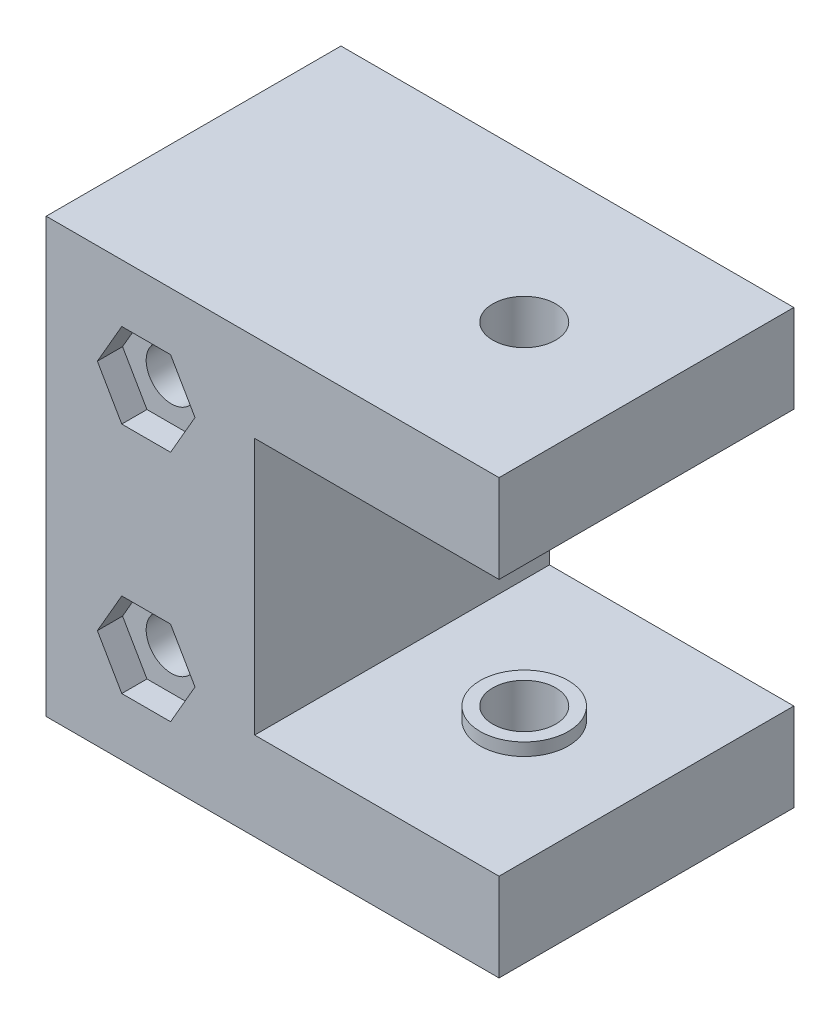
from build123d import *

# Parameters (mm, degrees)
MAINBLOCK_R                     = 2
MAINBLOCKBOSS_EXTRUDE1_DEPTH    = 23.4
TOPHOLECUT_SKETCH2_R            = 2.5
TOPHOLECUT_EXTRUDE1_DEPTH       = 30
MOUNTHOLEBORECUT_EXTRUDE2_DEPTH = 2
TOPSPACERSKETCH4_R              = 3.5
TOPSPACERSKETCH4_R_2            = 2.5
TOPSPACERBOSS_EXTRUDE2_DEPTH    = 1
LOWERSPACERBOSS_EXTRUDE3_START  = 1
LOWERSPACERSKETCH5_R            = 3.5
LOWERSPACERSKETCH5_R_2          = 2.5
LOWERSPACERBOSS_EXTRUDE3_DEPTH  = 1
PUSHPINHOLESKETCH1_R            = 1
PUSHPINHOLECUT_EXTRUDE1_DEPTH   = 55.984747885


with BuildPart() as part:
    # MainBlock → MainBlockBoss-Extrude1 (new body)
    with BuildSketch(Plane.XY):
        Polygon((0, 0), (35.95, 0), (35.95, 7), (16.55, 7), (16.55, 27.4), (35.95, 27.4), (35.95, 34.4), (0, 34.4), align=None)
        with Locations((7.9375, 26.4625)):
            Circle(MAINBLOCK_R, mode=Mode.SUBTRACT)
        with Locations((7.9375, 7.9375)):
            Circle(MAINBLOCK_R, mode=Mode.SUBTRACT)
    extrude(amount=MAINBLOCKBOSS_EXTRUDE1_DEPTH)

    # TopHoleCut-Sketch2 → TopHoleCut-Extrude1 (cut)
    with BuildSketch(Plane(origin=(0, 34.4, 0), x_dir=(1, 0, 0), z_dir=(0, 1, 0))):
        with Locations((26.25, -11.7)):
            Circle(TOPHOLECUT_SKETCH2_R)
    extrude(amount=-TOPHOLECUT_EXTRUDE1_DEPTH, mode=Mode.SUBTRACT)

    # MountHoleBoreSketch3 → MountHoleBoreCut-Extrude2 (cut)
    with BuildSketch(Plane.XY.offset(23.4)):
        Polygon((11.8125, 26.4625), (9.875, 29.81834844), (6, 29.81834844), (4.0625, 26.4625), (6, 23.10665156), (9.875, 23.10665156), align=None)
        Polygon((11.8125, 7.9375), (9.875, 11.29334844), (6, 11.29334844), (4.0625, 7.9375), (6, 4.58165156), (9.875, 4.58165156), align=None)
    extrude(amount=-MOUNTHOLEBORECUT_EXTRUDE2_DEPTH, mode=Mode.SUBTRACT)

    # TopSpacerSketch4 → TopSpacerBoss-Extrude2 (add)
    with BuildSketch(Plane.XZ.offset(-27.4)):
        with Locations((26.25, 11.7)):
            Circle(TOPSPACERSKETCH4_R)
        with Locations((26.25, 11.7)):
            Circle(TOPSPACERSKETCH4_R_2, mode=Mode.SUBTRACT)
    extrude(amount=TOPSPACERBOSS_EXTRUDE2_DEPTH)

    # LowerSpacerSketch5 → LowerSpacerBoss-Extrude3 (add)
    with BuildSketch(Plane(origin=(0, 7, 0), x_dir=(1, 0, 0), z_dir=(0, 1, 0)).offset(LOWERSPACERBOSS_EXTRUDE3_START)):
        with Locations((26.25, -11.7)):
            Circle(LOWERSPACERSKETCH5_R)
        with Locations((26.25, -11.7)):
            Circle(LOWERSPACERSKETCH5_R_2, mode=Mode.SUBTRACT)
    extrude(amount=-LOWERSPACERBOSS_EXTRUDE3_DEPTH)

    # PushPinHoleSketch1 → PushPinHoleCut-Extrude1 (cut, through all)
    with BuildSketch(Plane.XZ):
        with Locations((26.25, 11.7)):
            Circle(PUSHPINHOLESKETCH1_R)
    extrude(amount=-PUSHPINHOLECUT_EXTRUDE1_DEPTH, mode=Mode.SUBTRACT)


solid = part.part
